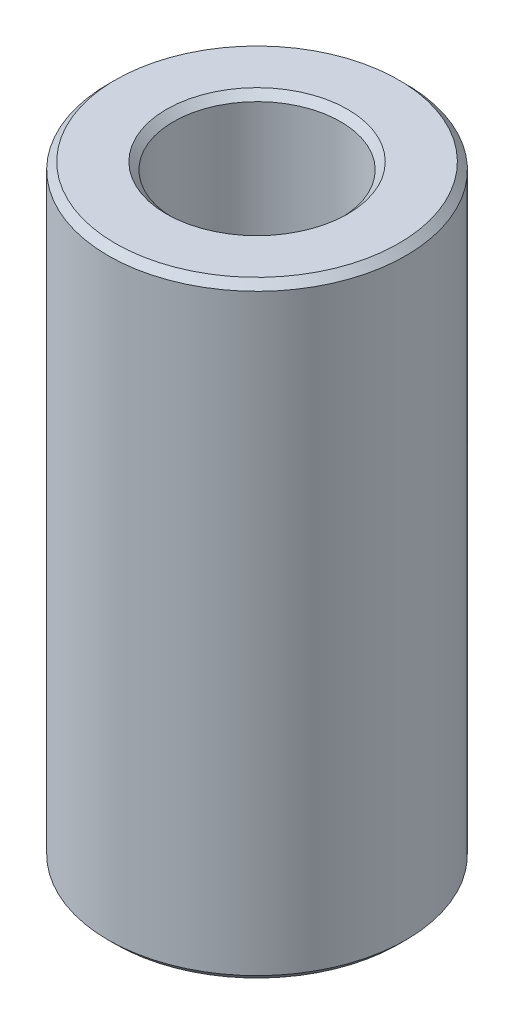
from build123d import *

# Parameters (mm, degrees)
SKETCH1_R           = 40
BOSS_EXTRUDE1_DEPTH = 163.158003155
SKETCH2_R           = 22.469918255
CUT_EXTRUDE1_DEPTH  = 173.68622989
CHAMFER1_SIZE       = 1.907503673


with BuildPart() as part:
    # Sketch1 → Boss-Extrude1 (new body)
    with BuildSketch(Plane(origin=(0, 0, 0), x_dir=(1, 0, 0), z_dir=(0, 1, 0))):
        Circle(SKETCH1_R)
    extrude(amount=BOSS_EXTRUDE1_DEPTH)

    # Sketch2 → Cut-Extrude1 (cut, through all)
    with BuildSketch(Plane(origin=(0, 0, 0), x_dir=(1, 0, 0), z_dir=(0, 1, 0))):
        Circle(SKETCH2_R)
    extrude(amount=CUT_EXTRUDE1_DEPTH, mode=Mode.SUBTRACT)

    # Chamfer1
    chamfer1_edges = [part.edges().sort_by_distance(p)[0] for p in [
        (-22.469918255, 163.158003155, 0),
        (-22.469918255, 0, 0),
        (-40, 0, 0),
        (-40, 163.158003155, 0),
    ]]
    chamfer(chamfer1_edges, length=CHAMFER1_SIZE)


solid = part.part
